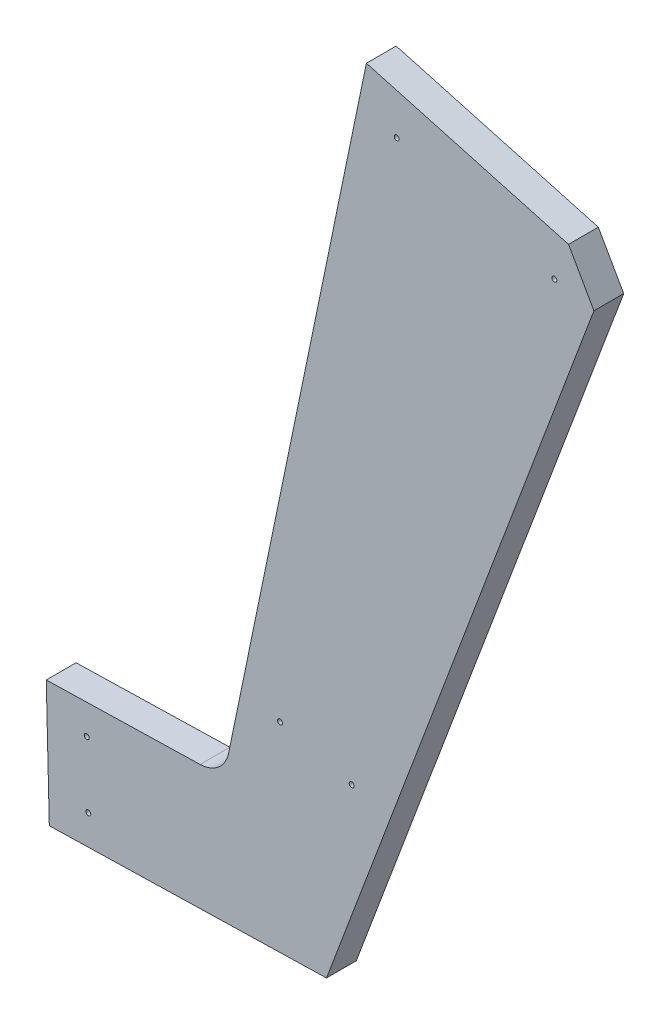
from build123d import *

# Parameters (mm, degrees)
BOSS_EXTRUDE1_DEPTH = 19.05
HOLE2_D             = 3.175
HOLE2_DEPTH         = 39.686133767
HOLE2_CSINK_D       = 10.16
HOLE2_CSINK_ANGLE   = 82
HOLE2_TIP           = 0.953866233


with BuildPart() as part:
    # Sketch1 → Boss-Extrude1 (new body)
    with BuildSketch(Plane.XY):
        with BuildLine():
            Line((-61.753066592, -505.133747826), (-59.805322331, -584.903623222))
            Line((-59.805322331, -584.903623222), (117.387139244, -580.57710775))
            Line((117.387139244, -580.57710775), (288.394610743, -125.650072018))
            Line((288.394610743, -125.650072018), (272.141590142, -96.993017293))
            Line((272.141590142, -96.993017293), (142.933900932, -61.306223753))
            Line((142.933900932, -61.306223753), (54.780700044, -487.546357698))
            ThreePointArc((54.780700044, -487.546357698), (48.334106484, -498.311851218), (36.590496304, -502.732489089))
            Line((36.590496304, -502.732489089), (-61.753066592, -505.133747826))
        make_face()
    extrude(amount=BOSS_EXTRUDE1_DEPTH)

    # Hole2
    with Locations(Plane(origin=(295.820901284, -105.894091108, -19.05), x_dir=(-0.3518626346959965, -0.9360516472421764, 8.51430303154421e-15), z_dir=(0, 0, -1))):
        with Locations((546.331381686, 147.924742102), (34.861843518, 129.510688231), (398.711186007, 72.427013068), (25.409302346, 25.4), (393.709302346, 25.4), (604.536477781, 403.287242286), (643.194157759, 387.668525745), (520.756836983, 195.925354764), (559.414516961, 180.306638222), (507.673701708, 163.543458643)):
            CounterSinkHole(HOLE2_D / 2, HOLE2_CSINK_D / 2, depth=HOLE2_DEPTH, counter_sink_angle=HOLE2_CSINK_ANGLE)
            with Locations((0, 0, -(HOLE2_DEPTH + HOLE2_TIP / 2))):  # 118° drill point
                Cone(0, HOLE2_D / 2, HOLE2_TIP, mode=Mode.SUBTRACT)


solid = part.part
